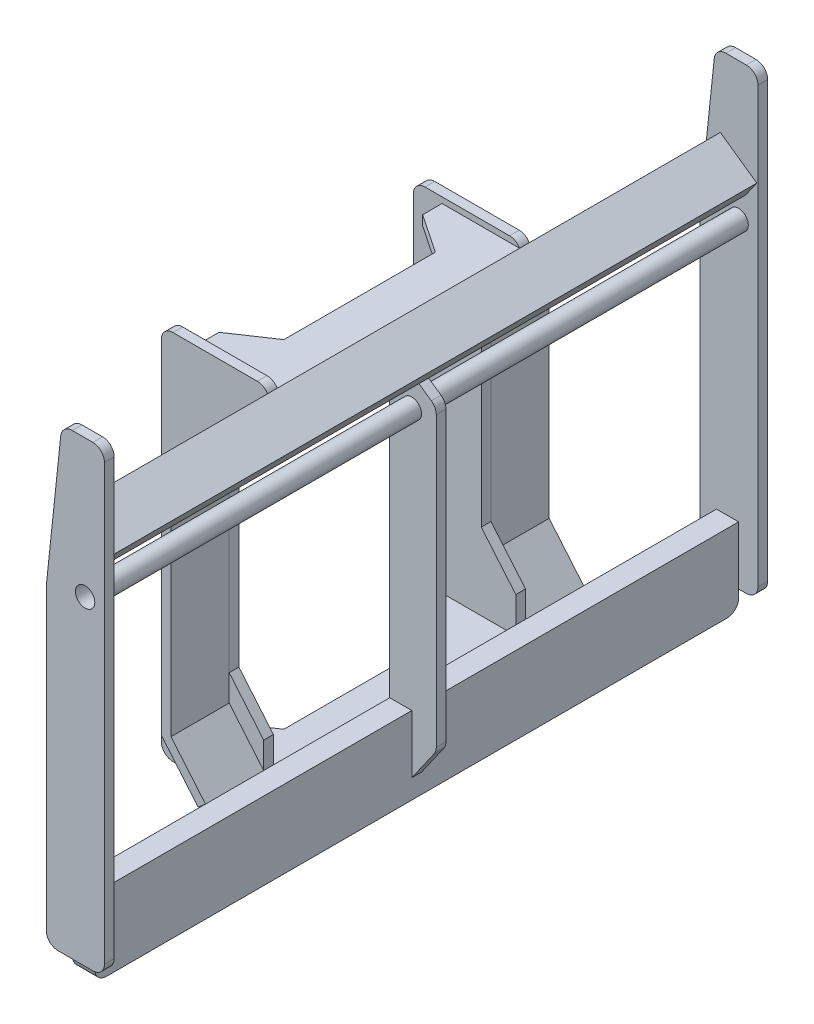
from build123d import *

# Parameters (mm, degrees)
BOSS_EXTRUDE1_START = 830
BOSS_EXTRUDE1_DEPTH = 25
BOSS_EXTRUDE2_START = -830
BOSS_EXTRUDE2_DEPTH = 25
SKETCH2_W           = 57
SKETCH2_H           = 200
BOSS_EXTRUDE3_DEPTH = 1660
BOSS_EXTRUDE4_DEPTH = 12.5
SKETCH4_R           = 25
CUT_EXTRUDE1_DEPTH  = 2084.026644093
BOSS_EXTRUDE5_START = -1685
SKETCH5_R           = 25.01
SKETCH5_R_2         = 25
BOSS_EXTRUDE5_DEPTH = 1660
BOSS_EXTRUDE6_START = 300
BOSS_EXTRUDE6_DEPTH = 25
EXTRUDE_THIN1_DEPTH = 150
BOSS_EXTRUDE7_REACH = 1429.345
SKETCH9_W           = 150
SKETCH9_H           = 25
BOSS_EXTRUDE8_DEPTH = 25
LPATTERN1_COUNT     = 2
LPATTERN1_PITCH     = 870
FILLET1_R           = 30


with BuildPart() as part:
    # Sketch1 → Boss-Extrude1 (new body)
    with BuildSketch(Plane.XY.offset(BOSS_EXTRUDE1_START)):
        Polygon((0, 1180), (0, 0), (-150, 0), (-150, 800), (-110, 1180), align=None)
    extrude(amount=BOSS_EXTRUDE1_DEPTH)



with BuildPart() as body_2:
    # Sketch1<2> → Boss-Extrude2 (new body)
    with BuildSketch(Plane.XY.offset(BOSS_EXTRUDE2_START)):
        Polygon((0, 1180), (0, 0), (-150, 0), (-150, 800), (-110, 1180), align=None)
    extrude(amount=-BOSS_EXTRUDE2_DEPTH)


with BuildPart() as part_1:
    add(part.part)

    add(body_2.part)  # Boss-Extrude3 merges body 2
    # Sketch2 → Boss-Extrude3 (add)
    with BuildSketch(Plane.XY.offset(-830)):
        Polygon((-3, 930), (-97.202485093, 995.96129018), (-125.881306911, 955.003687966), (-31.678821818, 889.042397786), align=None)
        with Locations((-78.5, 50)):
            Rectangle(SKETCH2_W, SKETCH2_H)
    extrude(amount=BOSS_EXTRUDE3_DEPTH)

    # Sketch3 → Boss-Extrude4 (add, symmetric)
    with BuildSketch(Plane.XY):
        Polygon((-107, 941.732958314), (-13.742380871, 876.433270404), (13, 857.708053729), (13, 89.973324425), (-50, 0), (-50, 150), (-107, 150), align=None)
    extrude(amount=BOSS_EXTRUDE4_DEPTH, both=True)

    # Sketch4 → Cut-Extrude1 (cut, through all)
    with BuildSketch(Plane.XY.offset(855)):
        with Locations((-50, 825)):
            Circle(SKETCH4_R)
    extrude(amount=-CUT_EXTRUDE1_DEPTH, mode=Mode.SUBTRACT)

    # Sketch5 → Boss-Extrude5 (add)
    with BuildSketch(Plane.XY.offset(855).offset(BOSS_EXTRUDE5_START)):
        with Locations((-50, 825)):
            Circle(SKETCH5_R)
        with Locations((-50, 825)):
            Circle(SKETCH5_R_2, mode=Mode.SUBTRACT)
    extrude(amount=BOSS_EXTRUDE5_DEPTH)

    # Sketch7 → Boss-Extrude6 (add)
    with BuildSketch(Plane(origin=(0, 0, -12.5), x_dir=(-1, 0, 0), z_dir=(0, 0, -1)).offset(BOSS_EXTRUDE6_START)):
        Polygon((97.202485093, 995.96129018), (125.881306911, 955.003687966), (78.780064364, 922.023042876), (78.811237587, 921.99497438), (107, 941.732958314), (107, 896.613698699), (196, 816.477738757), (196, 323.996024519), (107, 217.929954778), (107, 150), (107, 52.96129018), (371, 52.96129018), (371, 1010.96129018), (97.202485093, 1010.96129018), align=None)
    extrude(amount=BOSS_EXTRUDE6_DEPTH)


with BuildPart() as body_2_2:
    # Sketch8 → Extrude-Thin1 (new body)
    with BuildSketch(Plane(origin=(0, 0, -337.5), x_dir=(-1, 0, 0), z_dir=(0, 0, -1))):
        Polygon((107, 150), (196, 256.066069741), (196, 844.493461332), (107, 919.173328507), (123.069690242, 938.324439585), (221, 856.151152786), (221, 246.966813884), (126.151111078, 133.930309758), align=None)
    extrude(amount=EXTRUDE_THIN1_DEPTH)


with BuildPart() as body_3:
    # Boss-Extrude7: up to this plane
    boss_extrude7_end = Plane(origin=(-31.678821818, 889.042397786, 1037.963939182), z_dir=(0.5735764363510437, 0.8191520442889936, 0))
    # Sketch9 → Boss-Extrude7 (new, up to the surface)
    with BuildSketch(Plane(origin=(389.814332632, 327.09306274, 0), x_dir=(0, 0, -1), z_dir=(0.7660444431189808, 0.6427876096865363, 0)), mode=Mode.PRIVATE) as boss_extrude7_sk1:
        with Locations((412.5, 785.405894802)):
            Rectangle(SKETCH9_W, SKETCH9_H)
    boss_extrude7_tool1 = split(extrude(boss_extrude7_sk1.sketch, amount=BOSS_EXTRUDE7_REACH, mode=Mode.PRIVATE), bisect_by=boss_extrude7_end, keep=Keep.BOTH, mode=Mode.PRIVATE)
    add(boss_extrude7_tool1.solids().sort_by_distance((-115.034845, 928.748884, -412.5))[0])


with BuildPart() as body_4:
    # Mirror4: mirrored copy
    add(body_2_2.part.mirror(Plane.XY))


with BuildPart() as body_5:
    # Mirror4 2: mirrored copy
    add(body_3.part.mirror(Plane.XY))


with BuildPart() as body_6:
    # Mirror4 3: mirrored copy
    add(part_1.part.mirror(Plane.XY))


with BuildPart() as part_2:
    add(part_1.part)

    add(body_6.part)  # Boss-Extrude8 merges body 6
    # Sketch11 → Boss-Extrude8 (add)
    with BuildSketch(Plane(origin=(0, 995.96129018, 0), x_dir=(1, 0, 0), z_dir=(0, 1, 0))):
        Polygon((-297.202485093, 312.5), (-97.202485093, 312.5), (-97.202485093, -312.5), (-297.202485093, -312.5), (-297.202485093, -262.5), (-197.202485093, -195.317845765), (-197.202485093, 195.317845765), (-297.202485093, 262.5), align=None)
    boss_extrude8 = extrude(amount=-BOSS_EXTRUDE8_DEPTH)

    # LPattern1: Boss-Extrude8 ×2
    with Locations(*[(0, -i * LPATTERN1_PITCH, 0) for i in range(1, LPATTERN1_COUNT)]):
        add(boss_extrude8)

    # Fillet1
    # the kernel refuses this fillet: 30 mm, written as the material it takes off along each edge
    with BuildSketch(Plane(origin=(0, 1180, 755), x_dir=(-1, 0, 0), z_dir=(0, 0, 1)), Plane(origin=(0, 0, 755), x_dir=(0, 1, 0), z_dir=(0, 0, 1)), Plane(origin=(0, 1180, -755), x_dir=(0, -1, 0), z_dir=(0, 0, -1)), Plane(origin=(-371, 1010.96129018, -237.5), x_dir=(1, 0, 0), z_dir=(0, 0, -1)), Plane(origin=(-371, 1010.96129018, 237.5), x_dir=(0, -1, 0), z_dir=(0, 0, 1)), Plane(origin=(-371, 52.96129018, 237.5), x_dir=(1, 0, 0), z_dir=(0, 0, 1))) as fillet1_piece_1:
        with BuildLine():
            CenterArc((FILLET1_R, FILLET1_R), FILLET1_R, 180, 90)
            Line((0, FILLET1_R), (-FILLET1_R * 0.02, FILLET1_R))
            Line((-FILLET1_R * 0.02, FILLET1_R), (-FILLET1_R * 0.02, -FILLET1_R * 0.02))
            Line((-FILLET1_R * 0.02, -FILLET1_R * 0.02), (FILLET1_R, -FILLET1_R * 0.02))
            Line((FILLET1_R, -FILLET1_R * 0.02), (FILLET1_R, 0))
        make_face()
    extrude(amount=175, mode=Mode.SUBTRACT)
    with BuildSketch(Plane(origin=(-110, 1180, 762.480369048), x_dir=(1, 0, 0), z_dir=(0, 0, 1))) as fillet1_piece_2:
        with BuildLine():
            CenterArc((FILLET1_R * 0.900261746029, -FILLET1_R), FILLET1_R, 90, 83.990994043)
            Line((-FILLET1_R * 0.0942437068928, -FILLET1_R * 0.895315215482), (-FILLET1_R * 0.114133815951, -FILLET1_R * 0.893221519792))
            Line((-FILLET1_R * 0.114133815951, -FILLET1_R * 0.893221519792), (-FILLET1_R * 0.0180052349206, FILLET1_R * 0.02))
            Line((-FILLET1_R * 0.0180052349206, FILLET1_R * 0.02), (FILLET1_R * 0.900261746029, FILLET1_R * 0.02))
            Line((FILLET1_R * 0.900261746029, FILLET1_R * 0.02), (FILLET1_R * 0.900261746029, 0))
        make_face()
    extrude(amount=160.039261904, mode=Mode.SUBTRACT)
    with BuildSketch(Plane(origin=(-150, 0, 755), x_dir=(0, 1, 0), z_dir=(0, 0, 1)), Plane(origin=(0, 0, -755), x_dir=(0, 1, 0), z_dir=(0, 0, -1)), Plane(origin=(-150, 0, -755), x_dir=(1, 0, 0), z_dir=(0, 0, -1)), Plane(origin=(-371, 52.96129018, -237.5), x_dir=(1, 0, 0), z_dir=(0, 0, -1))) as fillet1_piece_3:
        with BuildLine():
            CenterArc((FILLET1_R, -FILLET1_R), FILLET1_R, 90, 90)
            Line((0, -FILLET1_R), (-FILLET1_R * 0.02, -FILLET1_R))
            Line((-FILLET1_R * 0.02, -FILLET1_R), (-FILLET1_R * 0.02, FILLET1_R * 0.02))
            Line((-FILLET1_R * 0.02, FILLET1_R * 0.02), (FILLET1_R, FILLET1_R * 0.02))
            Line((FILLET1_R, FILLET1_R * 0.02), (FILLET1_R, 0))
        make_face()
    extrude(amount=175, mode=Mode.SUBTRACT)
    with BuildSketch(Plane(origin=(25, -50, 830), x_dir=(0, 0, -1), z_dir=(-1, 0, 0)), Plane(origin=(25, -50, -830), x_dir=(0, 1, 0), z_dir=(-1, 0, 0))) as fillet1_piece_4:
        with BuildLine():
            CenterArc((FILLET1_R, -FILLET1_R), FILLET1_R, 90, 90)
            Line((0, -FILLET1_R), (-FILLET1_R * 0.02, -FILLET1_R))
            Line((-FILLET1_R * 0.02, -FILLET1_R), (-FILLET1_R * 0.02, FILLET1_R * 0.02))
            Line((-FILLET1_R * 0.02, FILLET1_R * 0.02), (FILLET1_R, FILLET1_R * 0.02))
            Line((FILLET1_R, FILLET1_R * 0.02), (FILLET1_R, 0))
        make_face()
    extrude(amount=207, mode=Mode.SUBTRACT)
    with BuildSketch(Plane(origin=(13, 857.708053729, -51.542528791), x_dir=(-0.8191520442889964, 0.5735764363510396, 0), z_dir=(0, 0, 1))) as fillet1_piece_5:
        with BuildLine():
            CenterArc((FILLET1_R * 0.520567050552, FILLET1_R), FILLET1_R, 215, 55)
            Line((-FILLET1_R * 0.298584993737, FILLET1_R * 0.426423563649), (-FILLET1_R * 0.314968034623, FILLET1_R * 0.414952034922))
            Line((-FILLET1_R * 0.314968034623, FILLET1_R * 0.414952034922), (-FILLET1_R * 0.010411341011, -FILLET1_R * 0.02))
            Line((-FILLET1_R * 0.010411341011, -FILLET1_R * 0.02), (FILLET1_R * 0.520567050552, -FILLET1_R * 0.02))
            Line((FILLET1_R * 0.520567050552, -FILLET1_R * 0.02), (FILLET1_R * 0.520567050552, 0))
        make_face()
    extrude(amount=103.085057583, mode=Mode.SUBTRACT)
    with BuildSketch(Plane(origin=(13, 89.973324425, -36.147409166), x_dir=(-0.5735764363510505, -0.8191520442889888, 0), z_dir=(0, 0, 1))) as fillet1_piece_6:
        with BuildLine():
            CenterArc((FILLET1_R * 0.315298788879, -FILLET1_R), FILLET1_R, 90, 35)
            Line((-FILLET1_R * 0.258277647472, -FILLET1_R * 0.180847955711), (-FILLET1_R * 0.269749176199, -FILLET1_R * 0.164464914825))
            Line((-FILLET1_R * 0.269749176199, -FILLET1_R * 0.164464914825), (-FILLET1_R * 0.00630597577758, FILLET1_R * 0.02))
            Line((-FILLET1_R * 0.00630597577758, FILLET1_R * 0.02), (FILLET1_R * 0.315298788879, FILLET1_R * 0.02))
            Line((FILLET1_R * 0.315298788879, FILLET1_R * 0.02), (FILLET1_R * 0.315298788879, 0))
        make_face()
    extrude(amount=72.294818332, mode=Mode.SUBTRACT)
    with BuildSketch(Plane(origin=(-110, 1180, -762.480369048), x_dir=(1, 0, 0), z_dir=(0, 0, -1))) as fillet1_piece_7:
        with BuildLine():
            CenterArc((FILLET1_R * 0.900261746029, FILLET1_R), FILLET1_R, 186.009005957, 83.990994043)
            Line((-FILLET1_R * 0.0942437068928, FILLET1_R * 0.895315215482), (-FILLET1_R * 0.114133815951, FILLET1_R * 0.893221519792))
            Line((-FILLET1_R * 0.114133815951, FILLET1_R * 0.893221519792), (-FILLET1_R * 0.0180052349206, -FILLET1_R * 0.02))
            Line((-FILLET1_R * 0.0180052349206, -FILLET1_R * 0.02), (FILLET1_R * 0.900261746029, -FILLET1_R * 0.02))
            Line((FILLET1_R * 0.900261746029, -FILLET1_R * 0.02), (FILLET1_R * 0.900261746029, 0))
        make_face()
    extrude(amount=160.039261904, mode=Mode.SUBTRACT)
    with BuildSketch(Plane(origin=(-97.202485093, 1010.96129018, -247.548094716), x_dir=(0, -1, 0), z_dir=(0, 0, -1))) as fillet1_piece_8:
        with BuildLine():
            CenterArc((30, 25.980762114), FILLET1_R, 180, 60)
            Line((0, 25.980762114), (-0.6, 25.980762114))
            Line((-0.6, 25.980762114), (-0.6, 0))
            Line((-0.6, 0), (0, -0.6))
            ThreePointArc((0, -0.6), (7.5, -0.6), (14.7, -0.519615242))
            Line((14.7, -0.519615242), (15, 0))
        make_face()
    extrude(amount=154.903810568, mode=Mode.SUBTRACT)
    with BuildSketch(Plane(origin=(-97.202485093, 1010.96129018, 247.548094716), x_dir=(0, -1, 0), z_dir=(0, 0, 1))) as fillet1_piece_9:
        with BuildLine():
            CenterArc((30, -25.980762114), FILLET1_R, 120, 60)
            Line((0, -25.980762114), (-0.6, -25.980762114))
            Line((-0.6, -25.980762114), (-0.6, 0))
            Line((-0.6, 0), (0, 0.6))
            ThreePointArc((0, 0.6), (7.5, 0.6), (14.7, 0.519615242))
            Line((14.7, 0.519615242), (15, 0))
        make_face()
    extrude(amount=154.903810568, mode=Mode.SUBTRACT)


solid = Compound([body_2_2.part, body_3.part, body_4.part, body_5.part, part_2.part])
